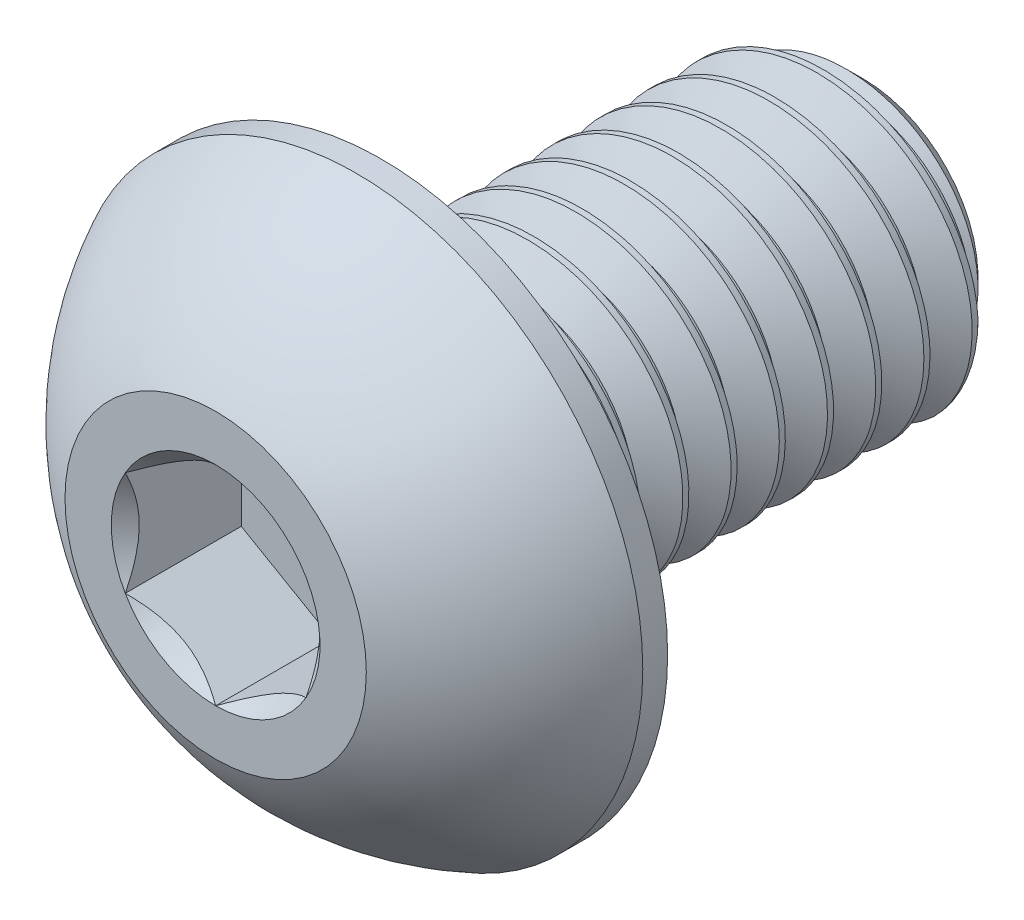
from build123d import *

# Parameters (mm, degrees)
SKETCH1_W          = 8
SKETCH1_H          = 2.5
CHAMFER1_SIZE      = 0.6
CUT_SWEEP1_PITCH   = 0.8
CUT_EXTRUDE2_DEPTH = 1.925


with BuildPart() as part:
    # Sketch1 → Revolve1 (revolve)
    with BuildSketch(Plane(origin=(0, 0, 0), x_dir=(0, 0, -1), z_dir=(1, 0, 0))):
        with Locations((6.75, 1.25)):
            Rectangle(SKETCH1_W, SKETCH1_H)
    revolve(axis=Axis((0, 0, -10.75), (0, 0, 1)))

    # Chamfer1
    chamfer1_edges = [part.edges().sort_by_distance(p)[0] for p in [
        (0, -2.5, -10.75),
    ]]
    chamfer(chamfer1_edges, length=CHAMFER1_SIZE)

    # Cut-Sweep1: the profile of Sketch2 profile screwed along a right-hand helix of 11 turns, 8 arcs to a turn; built about Z, then put on its axis
    cut_sweep1_z = Axis((0, 0, 0), (0, 0, 1))
    cut_sweep1_corners = [(2.5003, 0, 0.000173205), (2.5003, 0, -0.700173205), (1.980384758, 0, -0.4), (1.980384758, 0, -0.3)]
    with BuildLine(mode=Mode.PRIVATE) as cut_sweep1_profile:
        Line(cut_sweep1_corners[0], cut_sweep1_corners[1])
        Line(cut_sweep1_corners[1], cut_sweep1_corners[2])
        Line(cut_sweep1_corners[2], cut_sweep1_corners[3])
        Line(cut_sweep1_corners[3], cut_sweep1_corners[0])
    cut_sweep1_cap = Face(cut_sweep1_profile.wire())
    cut_sweep1_turn_angles = [0, 22.5, 45, 67.5, 90, 112.5, 135, 157.5, 180, 202.5, 225, 247.5, 270, 292.5, 315, 337.5, 360]
    cut_sweep1_turn_weights = [1, 0.9238795325112867, 1, 0.9238795325112867, 1, 0.9238795325112867, 1, 0.9238795325112867, 1, 0.9238795325112867, 1, 0.9238795325112867, 1, 0.9238795325112867, 1, 0.9238795325112867, 1]
    cut_sweep1_turn_rails = [Edge.make_bspline([Vector(p[0], p[1], 0).rotate(cut_sweep1_z, cut_sweep1_turn_angles[k]) / cut_sweep1_turn_weights[k] + Vector(0, 0, p[2] + CUT_SWEEP1_PITCH * cut_sweep1_turn_angles[k] / 360) for k in range(17)], [0, 0, 0, 1, 1, 2, 2, 3, 3, 4, 4, 5, 5, 6, 6, 7, 7, 8, 8, 8], 2, cut_sweep1_turn_weights) for p in cut_sweep1_corners]
    cut_sweep1_turn_sides = [Face.make_surface_from_curves(cut_sweep1_turn_rails[p[0]], cut_sweep1_turn_rails[p[1]]) for p in [(0, 1), (1, 2), (2, 3), (3, 0)]]
    cut_sweep1 = Plane(origin=(0, 0, -10.75), x_dir=(0, 1, 0), z_dir=(0, 0, 1)) * Solid(Shell([*[p.moved(Location((0, 0, CUT_SWEEP1_PITCH * i))) for i in range(11) for p in cut_sweep1_turn_sides], cut_sweep1_cap, cut_sweep1_cap.rotate(cut_sweep1_z, 3960).moved(Location((0, 0, CUT_SWEEP1_PITCH * 3960 / 360)))]))
    add(cut_sweep1, mode=Mode.SUBTRACT)

    # Sketch7 → Revolve2 (revolve)
    with BuildSketch(Plane(origin=(0, 0, 0), x_dir=(0, 0, -1), z_dir=(1, 0, 0)), mode=Mode.PRIVATE) as revolve2_sk:
        with BuildLine():
            Line((2.3375, 4.75), (2.75, 4.75))
            Line((2.75, 4.75), (2.75, 0))
            Line((2.75, 0), (0, 0))
            Line((0, 0), (0, 2.5))
            ThreePointArc((0, 2.5), (0.991875183, 3.808753282), (2.3375, 4.75))
        make_face()
    revolve(revolve2_sk.sketch.rotate(Axis((0, 0, 0), (0, 0, -1)), 189.052465709), axis=Axis((0, 0, 0), (0, 0, -1)))

    # Sketch5 → Cut-Extrude2 (cut)
    with BuildSketch(Plane.XY):
        Polygon((1.5, -0.866025404), (1.5, 0.866025404), (0, 1.732050808), (-1.5, 0.866025404), (-1.5, -0.866025404), (0, -1.732050808), align=None)
    extrude(amount=-CUT_EXTRUDE2_DEPTH, mode=Mode.SUBTRACT)

    # Cut-Extrude3 cone 1 section (through the dimple's axis) → Cut-Extrude3 (revolve, cut)
    with BuildSketch(Plane(origin=(0, 0, 0), x_dir=(0, -1, 0), z_dir=(1, 0, 0))):
        Polygon((0, 0), (1.732050808, 0), (0, 1.732050808), align=None)
    revolve(axis=Axis((0, 0, 0), (0, 0, -1)), mode=Mode.SUBTRACT)


solid = part.part
